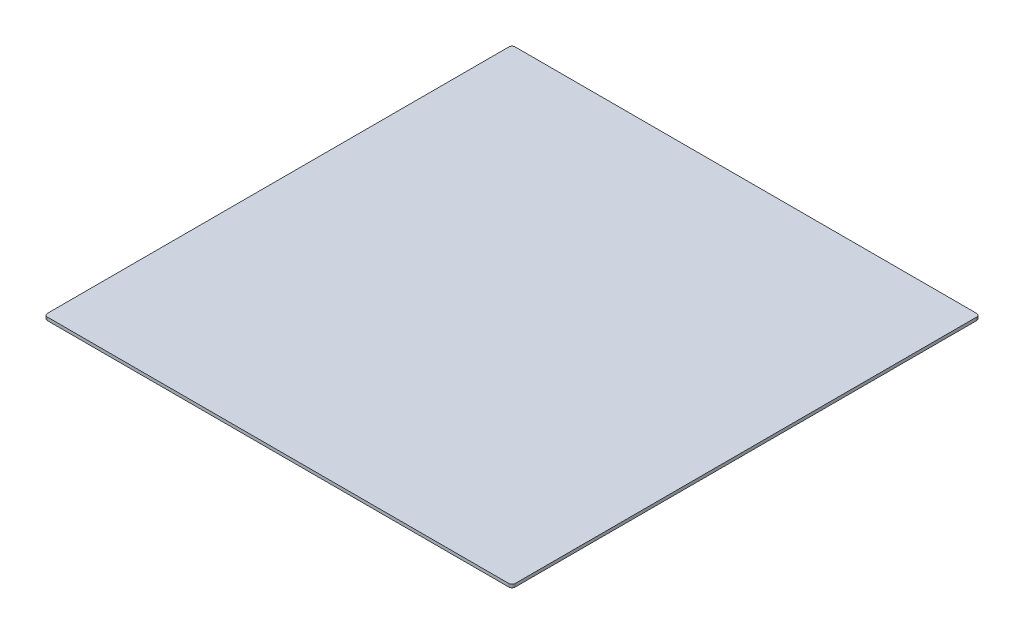
from build123d import *

# Parameters (mm, degrees)
BOSS_EXTRUDE1_DEPTH      = 1
BOSS_EXTRUDE1_DEPTH_BACK = 1
SKETCH1_W                = 300
SKETCH1_H                = 300
FILLET1_R                = 2


with BuildPart() as part:
    # Sketch1 → Boss-Extrude1 (new, two sides: drawn at the far end of the back side and taken through both)
    with BuildSketch(Plane(origin=(0, 0, 0), x_dir=(1, 0, 0), z_dir=(0, 1, 0)).offset(-BOSS_EXTRUDE1_DEPTH_BACK)):
        Rectangle(SKETCH1_W, SKETCH1_H)
    extrude(amount=BOSS_EXTRUDE1_DEPTH + BOSS_EXTRUDE1_DEPTH_BACK)

    # Fillet1
    fillet1_edges = [part.edges().sort_by_distance(p)[0] for p in [
        (-150, 0, -150),
        (150, 0, -150),
        (150, 0, 150),
        (-150, 0, 150),
    ]]
    fillet(fillet1_edges, radius=FILLET1_R)


solid = part.part
